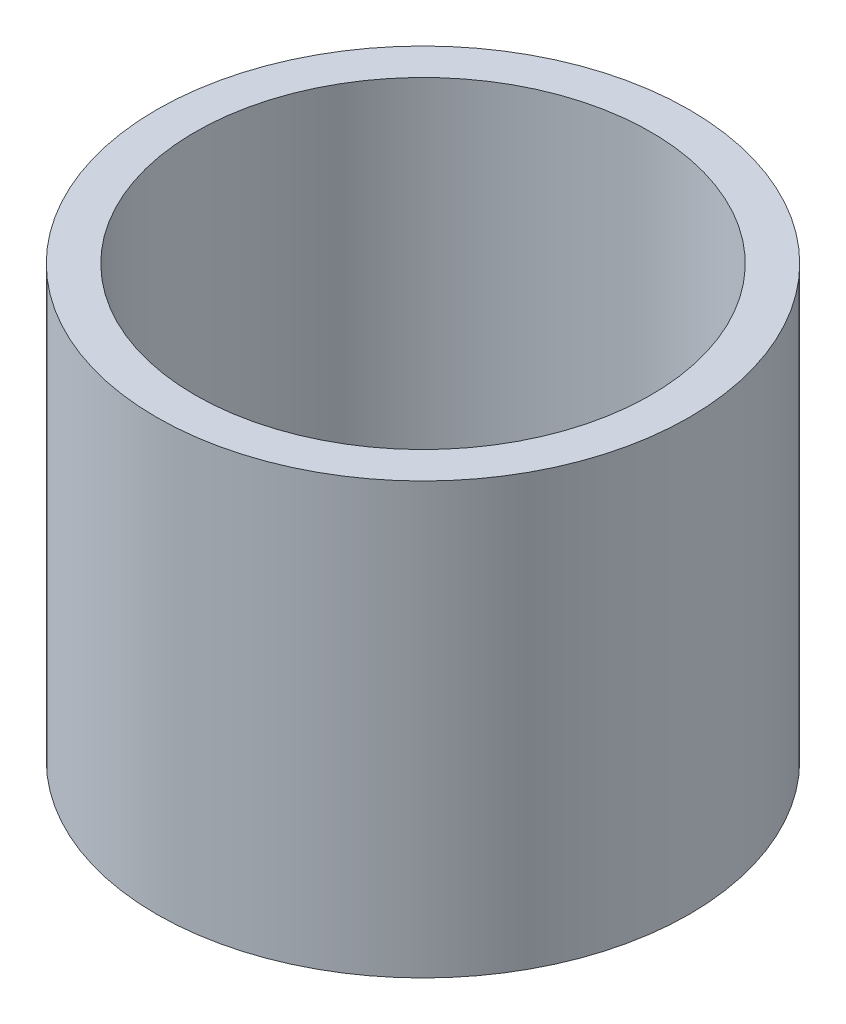
from build123d import *

# Parameters (mm, degrees)
SKETCH1_R           = 25
BOSS_EXTRUDE1_DEPTH = 40.389424985
SKETCH2_R           = 21.384348546
CUT_EXTRUDE1_DEPTH  = 54.677794763


with BuildPart() as part:
    # Sketch1 → Boss-Extrude1 (new body)
    with BuildSketch(Plane(origin=(0, 0, 0), x_dir=(1, 0, 0), z_dir=(0, 1, 0))):
        Circle(SKETCH1_R)
    extrude(amount=BOSS_EXTRUDE1_DEPTH)

    # Sketch2 → Cut-Extrude1 (cut, through all)
    with BuildSketch(Plane(origin=(0, 0, 0), x_dir=(1, 0, 0), z_dir=(0, 1, 0))):
        Circle(SKETCH2_R)
    extrude(amount=CUT_EXTRUDE1_DEPTH, mode=Mode.SUBTRACT)


solid = part.part
